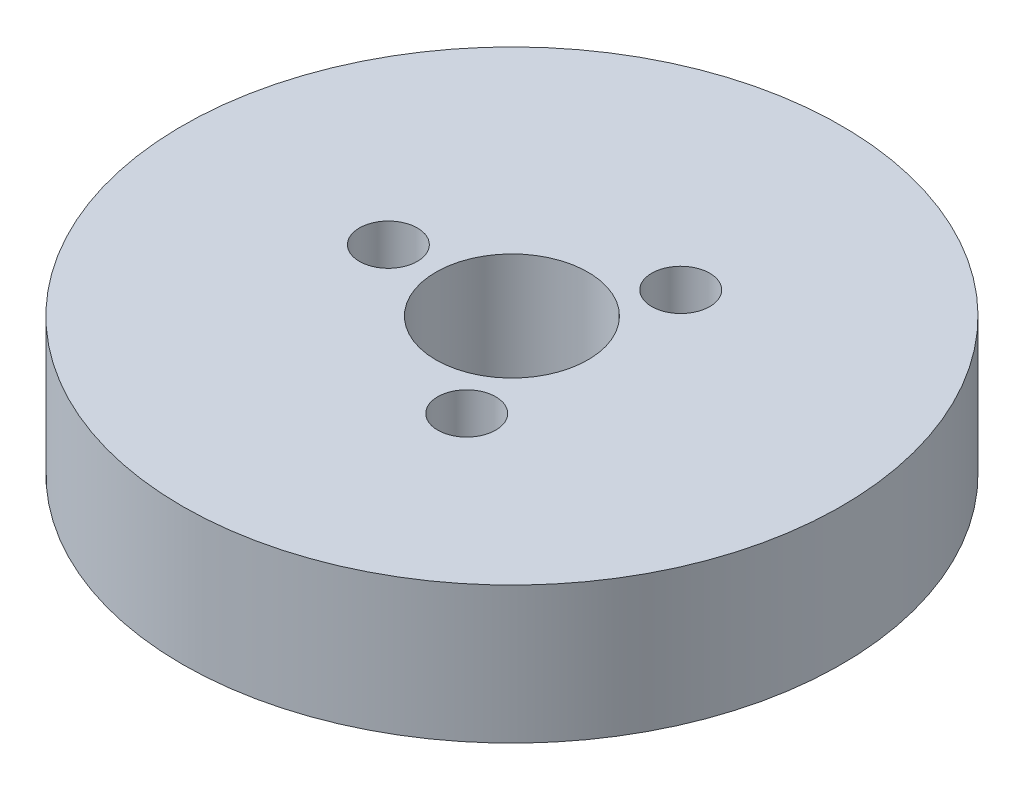
from build123d import *

# Parameters (mm, degrees)
SKETCH1_R           = 65
BOSS_EXTRUDE1_DEPTH = 27
SKETCH2_R           = 15
CUT_EXTRUDE1_DEPTH  = 96.807097858
SKETCH3_R           = 5.718025132
CUT_EXTRUDE2_DEPTH  = 22.737798203
CIRPATTERN1_COUNT   = 3


with BuildPart() as part:
    # Sketch1 → Boss-Extrude1 (new body)
    with BuildSketch(Plane(origin=(0, 0, 0), x_dir=(1, 0, 0), z_dir=(0, 1, 0))):
        Circle(SKETCH1_R)
    extrude(amount=BOSS_EXTRUDE1_DEPTH)

    # Sketch2 → Cut-Extrude1 (cut, through all)
    with BuildSketch(Plane(origin=(0, 0, 0), x_dir=(1, 0, 0), z_dir=(0, 1, 0))):
        Circle(SKETCH2_R)
    extrude(amount=CUT_EXTRUDE1_DEPTH, mode=Mode.SUBTRACT)

    # Sketch3 → Cut-Extrude2 (cut)
    with BuildSketch(Plane(origin=(0, 27, 0), x_dir=(1, 0, 0), z_dir=(0, 1, 0))):
        with Locations((-24.369619656, 0)):
            Circle(SKETCH3_R)
    cut_extrude2 = extrude(amount=-CUT_EXTRUDE2_DEPTH, mode=Mode.SUBTRACT)

    # CirPattern1: Cut-Extrude2 ×3 about axis
    cirpattern1_axis = Axis((0, 0, 0), (0, 1, 0))
    for i in range(1, CIRPATTERN1_COUNT):
        add(cut_extrude2.rotate(cirpattern1_axis, i * 360 / CIRPATTERN1_COUNT), mode=Mode.SUBTRACT)


solid = part.part
